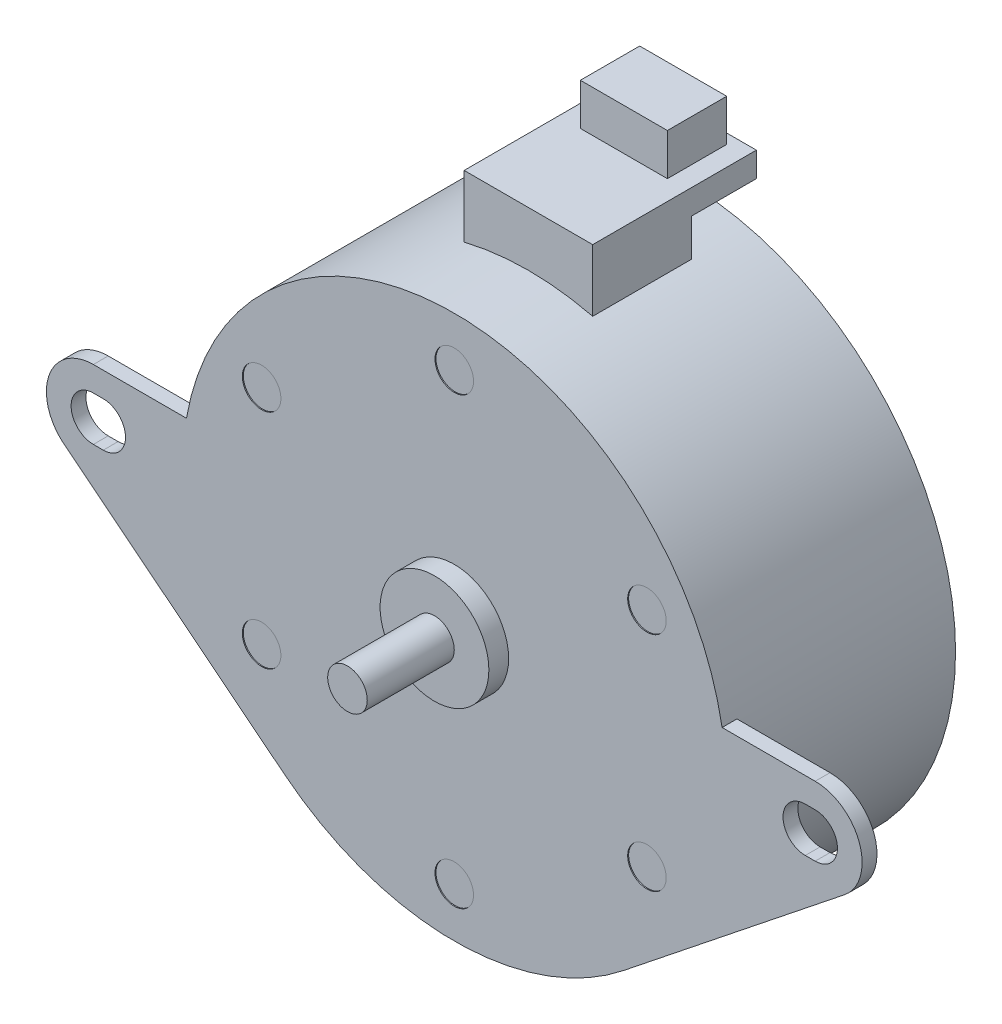
from build123d import *

# Parameters (mm, degrees)
SKETCH1_W                    = 27.5
SKETCH1_H                    = 23.2
BOSS_EXTRUDE1_REACH          = 86.991
SKETCH2_W                    = 13
SKETCH2_H                    = 10
SKETCH3_W                    = 13
SKETCH3_H                    = 2.5
BOSS_EXTRUDE2_DEPTH          = 16.55326241
BOSS_EXTRUDE3_DEPTH          = 1.5
BOSS_EXTRUDE4_DEPTH          = 1.5
CUT_EXTRUDE1_DEPTH           = 95.685647976
CUT_EXTRUDE2_DEPTH           = 95.315757672
SKETCH8_R                    = 5.5
BOSS_EXTRUDE5_DEPTH          = 2
SKETCH9_R                    = 2
BOSS_EXTRUDE6_DEPTH          = 8.8
SKETCH10_W                   = 8.8
SKETCH10_H                   = 6
BOSS_EXTRUDE7_DEPTH          = 4.22
CUT_EXTRUDE3_START           = -1
SKETCH11_W                   = 6.8
SKETCH11_H                   = 2.22
CUT_EXTRUDE3_DEPTH           = 5
SKETCH12_R                   = 19.15
BOSS_EXTRUDE8_DEPTH          = 1.5
BOSS_EXTRUDE8_TAPER          = 45
F_7_0_7_DIAMETER_HOLE1_D     = 7
F_7_0_7_DIAMETER_HOLE1_DEPTH = 1.5
SKETCH15_W                   = 1.95
SKETCH15_H                   = 0.1
SKETCH16_W                   = 1.95
SKETCH16_H                   = 0.1
SKETCH17_W                   = 1.95
SKETCH17_H                   = 0.1
SKETCH18_W                   = 1.95
SKETCH18_H                   = 0.1
SKETCH19_W                   = 1.95
SKETCH19_H                   = 0.1
SKETCH20_W                   = 1.95
SKETCH20_H                   = 0.1
SKETCH21_W                   = 2
SKETCH21_H                   = 7
SKETCH22_W                   = 1.95
SKETCH22_H                   = 0.9
SKETCH23_W                   = 1.95
SKETCH23_H                   = 0.9
SKETCH24_W                   = 1.95
SKETCH24_H                   = 0.9
SKETCH25_W                   = 1.95
SKETCH25_H                   = 0.9
SKETCH26_W                   = 1.95
SKETCH26_H                   = 0.9
SKETCH27_W                   = 1.95
SKETCH27_H                   = 0.9


with BuildPart() as part:
    # Sketch1 → Revolve1 (revolve)
    with BuildSketch(Plane.XZ.offset(-27.5)):
        with Locations((41.25, 11.6)):
            Rectangle(SKETCH1_W, SKETCH1_H)
    revolve(axis=Axis((27.5, 27.5, 23.2), (0, 0, -1)))

    # Sketch2 → Boss-Extrude1 (add, up to next)
    with BuildSketch(Plane(origin=(0, 60.5, 0), x_dir=(1, 0, 0), z_dir=(0, 1, 0)), mode=Mode.PRIVATE) as boss_extrude1_sk1:
        with Locations((27.5, -10.7)):
            Rectangle(SKETCH2_W, SKETCH2_H)
    boss_extrude1_tool1 = extrude(boss_extrude1_sk1.sketch, amount=-BOSS_EXTRUDE1_REACH, mode=Mode.PRIVATE) - part.part
    add(boss_extrude1_tool1.solids().sort_by_distance((27.5, 60.5, 10.7))[0])

    # Sketch3 → Boss-Extrude2 (add)
    with BuildSketch(Plane.XY.offset(15.7)):
        with Locations((27.5, 59.25)):
            Rectangle(SKETCH3_W, SKETCH3_H)
    extrude(amount=-BOSS_EXTRUDE2_DEPTH)

    # Sketch4 → Boss-Extrude3 (add)
    with BuildSketch(Plane.XY.offset(23.2)):
        with BuildLine():
            Line((64, 32.25), (54.586666462, 32.25))
            ThreePointArc((54.586666462, 32.25), (53.216477037, 17.757679496), (44.640410959, 5.995202578))
            Line((44.640410959, 5.995202578), (66.960616438, 23.785534991))
            ThreePointArc((66.960616438, 23.785534991), (68.483648559, 29.068246028), (64, 32.25))
        make_face()
    extrude(amount=-BOSS_EXTRUDE3_DEPTH)

    # Sketch5 → Boss-Extrude4 (add)
    with BuildSketch(Plane.XY.offset(23.2)):
        with BuildLine():
            Line((-11.960616438, 23.785534991), (10.359589041, 5.995202578))
            ThreePointArc((10.359589041, 5.995202578), (1.783522963, 17.757679496), (0.413333538, 32.25))
            Line((0.413333538, 32.25), (-9, 32.25))
            ThreePointArc((-9, 32.25), (-13.483648559, 29.068246028), (-11.960616438, 23.785534991))
        make_face()
    extrude(amount=-BOSS_EXTRUDE4_DEPTH)

    # Sketch6 → Cut-Extrude1 (cut, through all)
    with BuildSketch(Plane.XY.offset(23.2)):
        with BuildLine():
            Line((63, 25.25), (64, 25.25))
            ThreePointArc((64, 25.25), (66.25, 27.5), (64, 29.75))
            Line((64, 29.75), (63, 29.75))
            ThreePointArc((63, 29.75), (60.75, 27.5), (63, 25.25))
        make_face()
    extrude(amount=-CUT_EXTRUDE1_DEPTH, mode=Mode.SUBTRACT)

    # Sketch7 → Cut-Extrude2 (cut, through all)
    with BuildSketch(Plane(origin=(0, 0, 21.7), x_dir=(-1, 0, 0), z_dir=(0, 0, -1))):
        with BuildLine():
            Line((8, 25.25), (9, 25.25))
            ThreePointArc((9, 25.25), (11.25, 27.5), (9, 29.75))
            Line((9, 29.75), (8, 29.75))
            ThreePointArc((8, 29.75), (5.75, 27.5), (8, 25.25))
        make_face()
    extrude(amount=-CUT_EXTRUDE2_DEPTH, mode=Mode.SUBTRACT)

    # Sketch8 → Boss-Extrude5 (add)
    with BuildSketch(Plane.XY.offset(23.2)):
        with Locations((27.5, 27.5)):
            Circle(SKETCH8_R)
    extrude(amount=BOSS_EXTRUDE5_DEPTH)

    # Sketch9 → Boss-Extrude6 (add)
    with BuildSketch(Plane.XY.offset(25.2)):
        with Locations((27.5, 27.5)):
            Circle(SKETCH9_R)
    extrude(amount=BOSS_EXTRUDE6_DEPTH)

    # Sketch10 → Boss-Extrude7 (add)
    with BuildSketch(Plane(origin=(0, 60.5, 0), x_dir=(-1, 0, 0), z_dir=(0, 1, 0))):
        with Locations((-27.6, 3.14673759)):
            Rectangle(SKETCH10_W, SKETCH10_H)
    extrude(amount=BOSS_EXTRUDE7_DEPTH)

    # Sketch11 → Cut-Extrude3 (cut)
    with BuildSketch(Plane.XY.offset(6.14673759).offset(CUT_EXTRUDE3_START)):
        with Locations((27.6, 62.61)):
            Rectangle(SKETCH11_W, SKETCH11_H)
    extrude(amount=-CUT_EXTRUDE3_DEPTH, mode=Mode.SUBTRACT)

    # Sketch12 → Boss-Extrude8 (add)
    with BuildSketch(Plane(origin=(0, 0, 0), x_dir=(-1, 0, 0), z_dir=(0, 0, -1))):
        with Locations((-27.5, 27.5)):
            Circle(SKETCH12_R)
    extrude(amount=BOSS_EXTRUDE8_DEPTH, taper=BOSS_EXTRUDE8_TAPER)

    # Ø7.0 (7) Diameter Hole1
    with Locations(Plane(origin=(0, 0, -1.5), x_dir=(-1, 0, 0), z_dir=(0, 0, -1))):
        with Locations((-27.5, 27.5)):
            Hole(F_7_0_7_DIAMETER_HOLE1_D / 2, depth=F_7_0_7_DIAMETER_HOLE1_DEPTH)

    # Sketch15 → Cut-Revolve1 (revolve, cut)
    with BuildSketch(Plane(origin=(0, 16.25, 0), x_dir=(1, 0, 0), z_dir=(0, 1, 0))):
        with Locations((8.989428415, -23.15)):
            Rectangle(SKETCH15_W, SKETCH15_H)
    revolve(axis=Axis((8.014428415, 16.25, 23.1), (0, 0, 1)), mode=Mode.SUBTRACT)

    # Sketch16 → Cut-Revolve2 (revolve, cut)
    with BuildSketch(Plane(origin=(0, 5, 0), x_dir=(1, 0, 0), z_dir=(0, 1, 0))):
        with Locations((28.475, -23.15)):
            Rectangle(SKETCH16_W, SKETCH16_H)
    revolve(axis=Axis((27.5, 5, 23.1), (0, 0, 1)), mode=Mode.SUBTRACT)

    # Sketch17 → Cut-Revolve3 (revolve, cut)
    with BuildSketch(Plane(origin=(0, 16.25, 0), x_dir=(1, 0, 0), z_dir=(0, 1, 0))):
        with Locations((47.960571585, -23.15)):
            Rectangle(SKETCH17_W, SKETCH17_H)
    revolve(axis=Axis((46.985571585, 16.25, 23.1), (0, 0, 1)), mode=Mode.SUBTRACT)

    # Sketch18 → Cut-Revolve4 (revolve, cut)
    with BuildSketch(Plane(origin=(0, 38.75, 0), x_dir=(1, 0, 0), z_dir=(0, 1, 0))):
        with Locations((47.960571585, -23.15)):
            Rectangle(SKETCH18_W, SKETCH18_H)
    revolve(axis=Axis((46.985571585, 38.75, 23.1), (0, 0, 1)), mode=Mode.SUBTRACT)

    # Sketch19 → Cut-Revolve5 (revolve, cut)
    with BuildSketch(Plane(origin=(0, 50, 0), x_dir=(1, 0, 0), z_dir=(0, 1, 0))):
        with Locations((28.475, -23.15)):
            Rectangle(SKETCH19_W, SKETCH19_H)
    revolve(axis=Axis((27.5, 50, 23.1), (0, 0, 1)), mode=Mode.SUBTRACT)

    # Sketch20 → Cut-Revolve6 (revolve, cut)
    with BuildSketch(Plane(origin=(0, 38.75, 0), x_dir=(1, 0, 0), z_dir=(0, 1, 0))):
        with Locations((8.989428415, -23.15)):
            Rectangle(SKETCH20_W, SKETCH20_H)
    revolve(axis=Axis((8.014428415, 38.75, 23.1), (0, 0, 1)), mode=Mode.SUBTRACT)

    # Sketch21 → Revolve2 (revolve)
    with BuildSketch(Plane(origin=(0, 27.5, 0), x_dir=(1, 0, 0), z_dir=(0, 1, 0))):
        with Locations((28.5, 3.5)):
            Rectangle(SKETCH21_W, SKETCH21_H)
    revolve(axis=Axis((27.5, 27.5, -7), (0, 0, 1)))

    # Sketch22 → Revolve3 (revolve)
    with BuildSketch(Plane(origin=(0, 16.25, 0), x_dir=(1, 0, 0), z_dir=(0, 1, 0))):
        with Locations((47.960571585, 0.45)):
            Rectangle(SKETCH22_W, SKETCH22_H)
    revolve(axis=Axis((46.985571585, 16.25, -0.9), (0, 0, 1)))

    # Sketch23 → Revolve4 (revolve)
    with BuildSketch(Plane(origin=(0, 5, 0), x_dir=(1, 0, 0), z_dir=(0, 1, 0))):
        with Locations((28.475, 0.45)):
            Rectangle(SKETCH23_W, SKETCH23_H)
    revolve(axis=Axis((27.5, 5, -0.9), (0, 0, 1)))

    # Sketch24 → Revolve5 (revolve)
    with BuildSketch(Plane(origin=(0, 16.25, 0), x_dir=(1, 0, 0), z_dir=(0, 1, 0))):
        with Locations((8.989428415, 0.45)):
            Rectangle(SKETCH24_W, SKETCH24_H)
    revolve(axis=Axis((8.014428415, 16.25, -0.9), (0, 0, 1)))

    # Sketch25 → Revolve6 (revolve)
    with BuildSketch(Plane(origin=(0, 38.75, 0), x_dir=(1, 0, 0), z_dir=(0, 1, 0))):
        with Locations((8.989428415, 0.45)):
            Rectangle(SKETCH25_W, SKETCH25_H)
    revolve(axis=Axis((8.014428415, 38.75, -0.9), (0, 0, 1)))

    # Sketch26 → Revolve7 (revolve)
    with BuildSketch(Plane(origin=(0, 50, 0), x_dir=(1, 0, 0), z_dir=(0, 1, 0))):
        with Locations((28.475, 0.45)):
            Rectangle(SKETCH26_W, SKETCH26_H)
    revolve(axis=Axis((27.5, 50, -0.9), (0, 0, 1)))

    # Sketch27 → Revolve8 (revolve)
    with BuildSketch(Plane(origin=(0, 38.75, 0), x_dir=(1, 0, 0), z_dir=(0, 1, 0))):
        with Locations((47.960571585, 0.45)):
            Rectangle(SKETCH27_W, SKETCH27_H)
    revolve(axis=Axis((46.985571585, 38.75, -0.9), (0, 0, 1)))


solid = part.part
